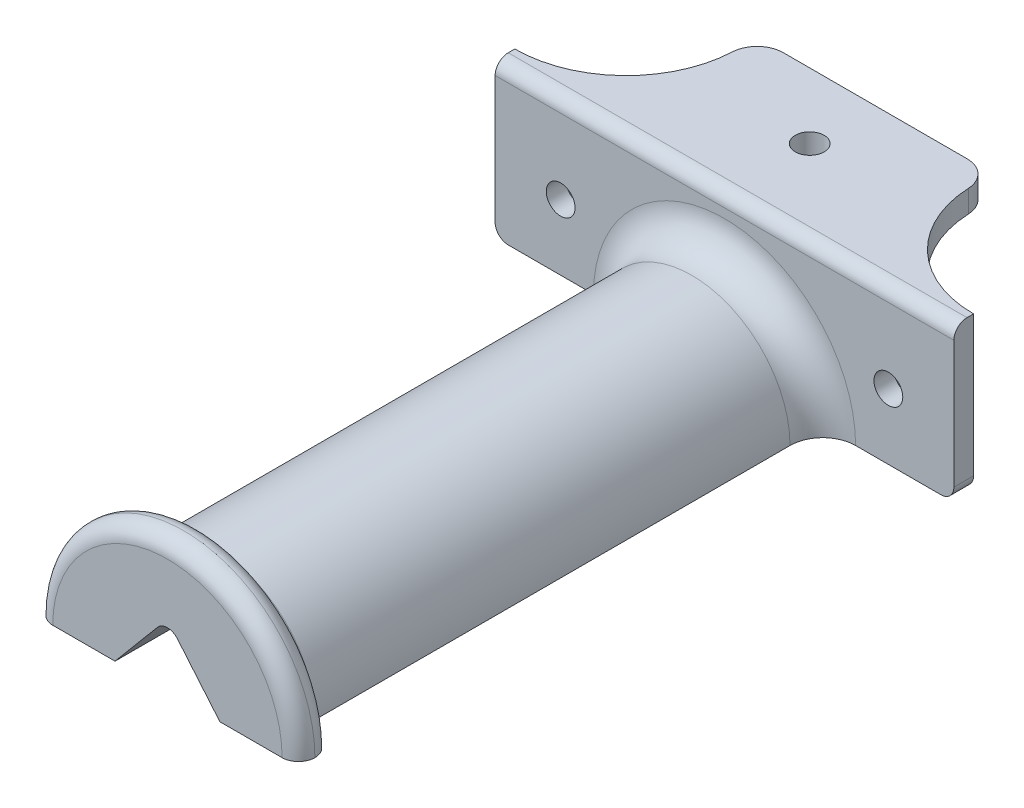
from build123d import *

# Parameters (mm, degrees)
BOSS_EXTRUDE1_DEPTH = 35
CUT_EXTRUDE1_DEPTH  = 48.974576601
FILLET1_R           = 4
SKETCH3_R           = 2.2
CUT_EXTRUDE2_DEPTH  = 48.974576601
BOSS_EXTRUDE2_DEPTH = 85
FILLET2_R           = 2
FILLET3_R           = 5
BOSS_EXTRUDE3_DEPTH = 5
FILLET4_R           = 2.5
SKETCH6_R           = 2.2
CUT_EXTRUDE3_DEPTH  = 95.855469004
CUT_EXTRUDE4_DEPTH  = 79.1


with BuildPart() as part:
    # Sketch1 → Boss-Extrude1 (new, symmetric)
    with BuildSketch(Plane(origin=(0, 0, 0), x_dir=(0, 0, -1), z_dir=(1, 0, 0))):
        Polygon((0, 0), (0, 23.4), (23, 23.4), (23, 20), (3, 20), (3, 0), align=None)
    extrude(amount=BOSS_EXTRUDE1_DEPTH, both=True)

    # Sketch2 → Cut-Extrude1 (cut, through all)
    with BuildSketch(Plane(origin=(0, 23.4, 0), x_dir=(1, 0, 0), z_dir=(0, 1, 0))):
        with BuildLine():
            Line((-35, 3), (-35, 23))
            Line((-35, 23), (-18.266799469, 23))
            ThreePointArc((-18.266799469, 23), (-21.96159519, 9.091287885), (-35, 3))
        make_face()
        with BuildLine():
            Line((35, 23), (35, 3))
            ThreePointArc((35, 3), (21.96159519, 9.091287885), (18.266799469, 23))
            Line((18.266799469, 23), (35, 23))
        make_face()
    extrude(amount=-CUT_EXTRUDE1_DEPTH, mode=Mode.SUBTRACT)

    # Fillet1
    fillet1_edges = [part.edges().sort_by_distance(p)[0] for p in [
        (-18.266799469, 21.7, -23),
        (18.266799469, 21.7, -23),
    ]]
    fillet(fillet1_edges, radius=FILLET1_R)

    # Sketch3 → Cut-Extrude2 (cut, through all)
    with BuildSketch(Plane(origin=(0, 23.4, 0), x_dir=(1, 0, 0), z_dir=(0, 1, 0))):
        with Locations(Location((0, 13, 0), (0, 0, 270))):
            Circle(SKETCH3_R)
    extrude(amount=-CUT_EXTRUDE2_DEPTH, mode=Mode.SUBTRACT)

    # Sketch4 → Boss-Extrude2 (add)
    with BuildSketch(Plane.XY):
        with BuildLine():
            Line((-15, 0), (15, 0))
            ThreePointArc((15, 0), (0, 15), (-15, 0))
        make_face()
    extrude(amount=BOSS_EXTRUDE2_DEPTH)

    # Fillet2
    fillet2_edges = [part.edges().sort_by_distance(p)[0] for p in [
        (0, 23.4, 0),
        (35, 0, -1.5),
        (-35, 0, -1.5),
    ]]
    fillet(fillet2_edges, radius=FILLET2_R)

    # Fillet3
    fillet3_edges = [part.edges().sort_by_distance(p)[0] for p in [
        (0, 15, 0),
    ]]
    fillet(fillet3_edges, radius=FILLET3_R)

    # Sketch5 → Boss-Extrude3 (add)
    with BuildSketch(Plane.XY.offset(85)):
        with BuildLine():
            Line((-20, 0), (20, 0))
            ThreePointArc((20, 0), (0, 20), (-20, 0))
        make_face()
    extrude(amount=-BOSS_EXTRUDE3_DEPTH)

    # Fillet4
    fillet4_edges = [part.edges().sort_by_distance(p)[0] for p in [
        (0, 15, 80),
        (0, 20, 85),
        (0, 20, 80),
    ]]
    fillet(fillet4_edges, radius=FILLET4_R - 0.0001)  # a hair under: the kernel refuses the full size

    # Sketch6 → Cut-Extrude3 (cut, through all)
    with BuildSketch(Plane.XY):
        with Locations((-25, 10)):
            Circle(SKETCH6_R)
        with Locations((25, 10)):
            Circle(SKETCH6_R)
    extrude(amount=-CUT_EXTRUDE3_DEPTH, mode=Mode.SUBTRACT)

    # Sketch7 → Cut-Extrude4 (cut)
    with BuildSketch(Plane.XY.offset(85)):
        with BuildLine():
            Line((-8, 0), (-1.532088886, 7.708156306))
            ThreePointArc((-1.532088886, 7.708156306), (0, 8.422581087), (1.532088886, 7.708156306))
            Line((1.532088886, 7.708156306), (8, 0))
            Line((8, 0), (-8, 0))
        make_face()
    extrude(amount=-CUT_EXTRUDE4_DEPTH, mode=Mode.SUBTRACT)

    # Cut-Loft1: read off the stored shape, not the designer's step
    # Cut-Loft1: loft between two sections, ruled curve by curve
    cut_loft1_from = [
        Edge.make_bspline([(8, 0, 5.9), (7.808229478, 0, 5.132917912), (7.200602425, 0, 3.64796349), (5.687204842, 0, 1.769877251), (3.709324875, 0, 0.407557368), (2.203369637, 0, -0.084384364), (1.187686781, 0, -0.264169601), (0.704669985, 0, -0.326297117), (-9.712e-06, 0, -0.356163583), (-0.70465377, 0, -0.326303947), (-1.187686781, 0, -0.264169601), (-2.203369637, 0, -0.084384364), (-3.709324875, 0, 0.407557368), (-5.687204842, 0, 1.769877251), (-7.200602425, 0, 3.64796349), (-7.808229478, 0, 5.132917912), (-8, 0, 5.9)], [0, 0, 0, 0, 0.107487262, 0.214974523, 0.322461785, 0.429949046, 0.429949046, 0.464974523, 0.5, 0.535025477, 0.570050954, 0.570050954, 0.677538215, 0.785025477, 0.892512738, 1, 1, 1, 1], 3),
        Edge.make_line((-8, 0, 5.9), (8, 0, 5.9)),
    ]
    cut_loft1_to = [
        Edge.make_bspline([(8, 0, 5.9), (7.461007407, 0.642346359, 5.9), (6.387217166, 1.922039736, 5.9), (4.779653043, 3.837860055, 5.9), (3.165945257, 5.761002107, 5.9), (2.079638077, 7.055612591, 5.9), (1.35366615, 7.920792244, 5.9), (0.893536846, 8.285398196, 5.9), (0, 8.491560625, 5.9), (-0.893536846, 8.285398196, 5.9), (-1.35366615, 7.920792244, 5.9), (-2.079638077, 7.055612591, 5.9), (-3.165945257, 5.761002107, 5.9), (-4.779653043, 3.837860055, 5.9), (-6.387217166, 1.922039736, 5.9), (-7.461007407, 0.642346359, 5.9), (-8, 0, 5.9)], [0, 0, 0, 0, 0.107487262, 0.214974523, 0.322461785, 0.429949046, 0.429949046, 0.464974523, 0.5, 0.535025477, 0.570050954, 0.570050954, 0.677538215, 0.785025477, 0.892512738, 1, 1, 1, 1], 3),
        Edge.make_line((-8, 0, 5.9), (8, 0, 5.9)),
    ]
    cut_loft1 = Solid(Shell([*[Face.make_surface_from_curves(cut_loft1_from[k], cut_loft1_to[k]) for k in range(2)], Face(Wire(cut_loft1_from)), Face(Wire(cut_loft1_to))]))
    add(cut_loft1, mode=Mode.SUBTRACT)


solid = part.part
